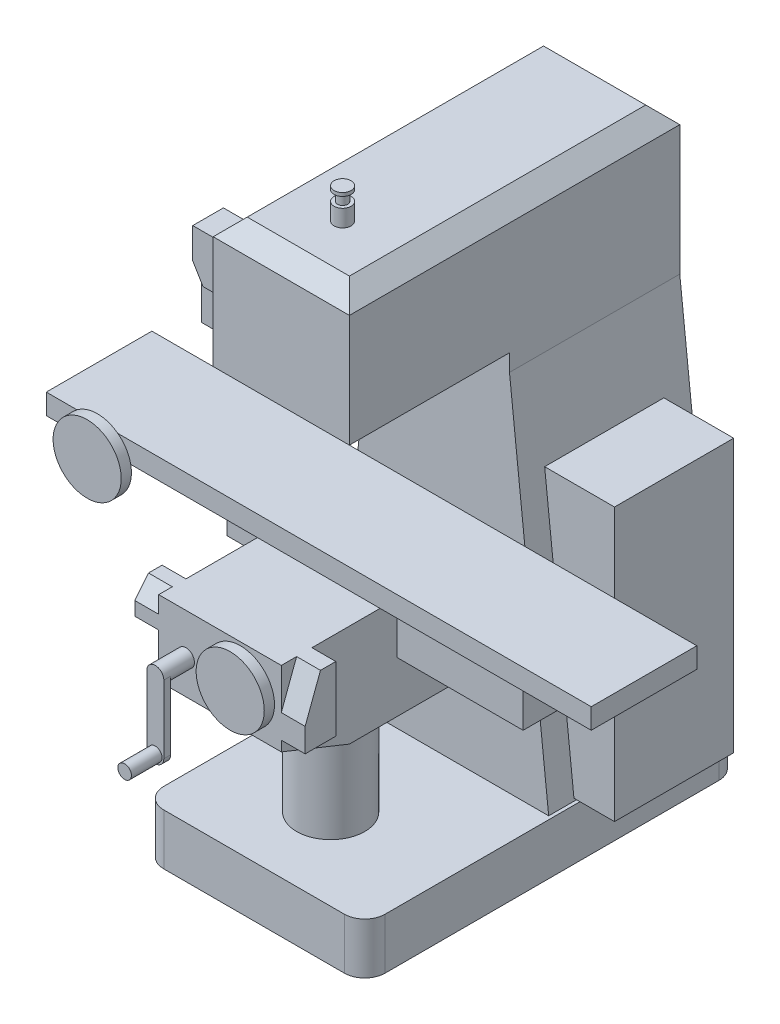
from build123d import *

# Parameters (mm, degrees)
SKETCH_2_W          = 400
SKETCH_2_H          = 430
EXTRUDE_2_DEPTH     = 970
EXTRUDE_3_DEPTH     = 500
SKETCH_4_W          = 650
SKETCH_4_H          = 1100
EXTRUDE_4_DEPTH     = 150
SKETCH_5_R          = 25
EXTRUDE_5_DEPTH     = 50
SKETCH_6_R          = 15
EXTRUDE_6_DEPTH     = 30
SKETCH_7_R          = 25
EXTRUDE_7_DEPTH     = 10
CHAMFER_1_SIZE      = 50
SKETCH_8_R          = 55
EXTRUDE_8_DEPTH     = 20
SKETCH_9_R          = 50
EXTRUDE_9_DEPTH     = 40
CHAMFER_2_SIZE      = 15
SKETCH_10_R         = 10
EXTRUDE_10_DEPTH    = 50
SKETCH_11_W         = 360
SKETCH_11_H         = 300
EXTRUDE_11_DEPTH    = 660
SKETCH_12_W         = 1600
SKETCH_12_H         = 310
EXTRUDE_12_DEPTH    = 60
SKETCH_13_W         = 350
SKETCH_13_H         = 800
EXTRUDE_13_DEPTH    = 570
SKETCH_14_R         = 100
EXTRUDE_14_DEPTH    = 400
EXTRUDE_15_DEPTH    = 100
CUT_EXTRUDE_1_DEPTH = 10
SKETCH_17_R         = 100
EXTRUDE_16_DEPTH    = 30
CUT_EXTRUDE_2_REACH = 2181.284
SKETCH_19_W         = 370
SKETCH_19_H         = 210
EXTRUDE_17_DEPTH    = 150
SKETCH_20_W         = 150
SKETCH_20_H         = 200
EXTRUDE_18_DEPTH    = 100
SKETCH_21_R         = 25
EXTRUDE_19_DEPTH    = 70
SKETCH_22_R         = 100
EXTRUDE_20_DEPTH    = 30
EXTRUDE_21_DEPTH    = 20
SKETCH_24_R         = 20
EXTRUDE_22_DEPTH    = 90
SKETCH_25_W         = 80
SKETCH_25_H         = 90
EXTRUDE_23_DEPTH    = 70
CUT_EXTRUDE_3_DEPTH = 70
SKETCH_27_W         = 90
SKETCH_27_H         = 190
EXTRUDE_24_DEPTH    = 70
CUT_EXTRUDE_4_DEPTH = 70
FILLET_1_R          = 60
SKETCH_29_W         = 50
SKETCH_29_H         = 50
EXTRUDE_25_DEPTH    = 200
SKETCH_30_W         = 50
SKETCH_30_H         = 50
EXTRUDE_26_DEPTH    = 150
SKETCH_31_W         = 260
SKETCH_31_H         = 160
EXTRUDE_27_DEPTH    = 80


with BuildPart() as part:
    # ｽｹｯﾁ2 → ﾎﾞｽ - 押し出し2 (new body)
    with BuildSketch(Plane.XY):
        with Locations((136.676642933, -128.098797217)):
            Rectangle(SKETCH_2_W, SKETCH_2_H)
    extrude(amount=EXTRUDE_2_DEPTH)

    # ｽｹｯﾁ3 → ﾎﾞｽ - 押し出し3 (add)
    with BuildSketch(Plane(origin=(0, 0, 0), x_dir=(-1, 0, 0), z_dir=(0, 0, -1))):
        Polygon((63.323357067, -343.098797217), (-336.676642933, -343.098797217), (-451.676642933, -1413.098797217), (178.323357067, -1413.098797217), align=None)
    extrude(amount=-EXTRUDE_3_DEPTH)

    # ｽｹｯﾁ4 → ﾎﾞｽ - 押し出し4 (add)
    with BuildSketch(Plane(origin=(0, -1413.098797217, 0), x_dir=(-1, 0, 0), z_dir=(0, -1, 0))):
        with Locations((-136.676642933, -500)):
            Rectangle(SKETCH_4_W, SKETCH_4_H)
    extrude(amount=EXTRUDE_4_DEPTH)

    # ｽｹｯﾁ5 → ﾎﾞｽ - 押し出し5 (add)
    with BuildSketch(Plane(origin=(0, 86.901202783, 0), x_dir=(1, 0, 0), z_dir=(0, 1, 0))):
        with Locations((136.676642933, -790)):
            Circle(SKETCH_5_R)
    extrude(amount=EXTRUDE_5_DEPTH)

    # ｽｹｯﾁ6 → ﾎﾞｽ - 押し出し6 (add)
    with BuildSketch(Plane(origin=(0, 136.901202783, 0), x_dir=(1, 0, 0), z_dir=(0, 1, 0))):
        with Locations((136.676642933, -790)):
            Circle(SKETCH_6_R)
    extrude(amount=EXTRUDE_6_DEPTH)

    # ｽｹｯﾁ7 → ﾎﾞｽ - 押し出し7 (add)
    with BuildSketch(Plane(origin=(0, 166.901202783, 0), x_dir=(1, 0, 0), z_dir=(0, 1, 0))):
        with Locations((136.676642933, -790)):
            Circle(SKETCH_7_R)
    extrude(amount=EXTRUDE_7_DEPTH)

    # 面取り1
    chamfer_1_edges = [part.edges().sort_by_distance(p)[0] for p in [
        (-63.323357067, 86.901202783, 485),
        (136.676642933, 86.901202783, 0),
        (136.676642933, 86.901202783, 970),
        (336.676642933, 86.901202783, 485),
        (-63.323357067, -343.098797217, 735),
        (336.676642933, -343.098797217, 735),
        (136.676642933, -343.098797217, 970),
    ]]
    chamfer(chamfer_1_edges, length=CHAMFER_1_SIZE)

    # ｽｹｯﾁ8 → ﾎﾞｽ - 押し出し8 (add)
    with BuildSketch(Plane(origin=(0, -343.098797217, 0), x_dir=(-1, 0, 0), z_dir=(0, -1, 0))):
        with Locations((-136.676642933, -790)):
            Circle(SKETCH_8_R)
    extrude(amount=EXTRUDE_8_DEPTH)

    # ｽｹｯﾁ9 → ﾎﾞｽ - 押し出し9 (add)
    with BuildSketch(Plane(origin=(0, -363.098797217, 0), x_dir=(-1, 0, 0), z_dir=(0, -1, 0))):
        with Locations((-136.676642933, -790)):
            Circle(SKETCH_9_R)
    extrude(amount=EXTRUDE_9_DEPTH)

    # 面取り2
    chamfer_2_edges = [part.edges().sort_by_distance(p)[0] for p in [
        (186.676642933, -403.098797217, 790),
    ]]
    chamfer(chamfer_2_edges, length=CHAMFER_2_SIZE)

    # ｽｹｯﾁ10 → ﾎﾞｽ - 押し出し10 (add)
    with BuildSketch(Plane(origin=(0, -403.098797217, 0), x_dir=(-1, 0, 0), z_dir=(0, -1, 0))):
        with Locations((-136.676642933, -790)):
            Circle(SKETCH_10_R)
    extrude(amount=EXTRUDE_10_DEPTH)

    # ｽｹｯﾁ11 → ﾎﾞｽ - 押し出し11 (add)
    with BuildSketch(Plane.XY.offset(500)):
        with Locations((146.676642933, -913.098797217)):
            Rectangle(SKETCH_11_W, SKETCH_11_H)
    extrude(amount=EXTRUDE_11_DEPTH)

    # ｽｹｯﾁ12 → ﾎﾞｽ - 押し出し12 (add)
    with BuildSketch(Plane(origin=(0, -763.098797217, 0), x_dir=(1, 0, 0), z_dir=(0, 1, 0))):
        with Locations((146.676642933, -715)):
            Rectangle(SKETCH_12_W, SKETCH_12_H)
    extrude(amount=EXTRUDE_12_DEPTH)

    # ｽｹｯﾁ13 → ﾎﾞｽ - 押し出し13 (add)
    with BuildSketch(Plane(origin=(0, 0, 0), x_dir=(0, 0, -1), z_dir=(1, 0, 0))):
        with Locations((-250, -1006.142275478)):
            Rectangle(SKETCH_13_W, SKETCH_13_H)
    extrude(amount=EXTRUDE_13_DEPTH)

    # ｽｹｯﾁ14 → ﾎﾞｽ - 押し出し14 (add)
    with BuildSketch(Plane(origin=(0, -1413.098797217, 0), x_dir=(1, 0, 0), z_dir=(0, 1, 0))):
        with Locations((121.676642933, -810)):
            Circle(SKETCH_14_R)
    extrude(amount=EXTRUDE_14_DEPTH)

    # ｽｹｯﾁ15 → ﾎﾞｽ - 押し出し15 (add)
    with BuildSketch(Plane.XY.offset(970)):
        Polygon((-63.323357067, 25.333856753), (-133.323357067, 25.333856753), (-133.323357067, -64.666143247), (-103.323357067, -114.666143247), (-63.323357067, -114.666143247), align=None)
    extrude(amount=-EXTRUDE_15_DEPTH)

    # ｽｹｯﾁ16 → ｶｯﾄ - 押し出し1 (cut)
    with BuildSketch(Plane.XY.offset(970)):
        Polygon((-63.323357067, 25.333856753), (-133.323357067, 25.333856753), (-133.323357067, -64.666143247), (-103.323357067, -114.666143247), (-63.323357067, -114.666143247), align=None)
    extrude(amount=-CUT_EXTRUDE_1_DEPTH, mode=Mode.SUBTRACT)

    # ｽｹｯﾁ17 → ﾎﾞｽ - 押し出し16 (add)
    with BuildSketch(Plane.XY.offset(870)):
        with Locations((-503.323357067, -783.098797217)):
            Circle(SKETCH_17_R)
    extrude(amount=EXTRUDE_16_DEPTH)

    # ｽｹｯﾁ18 → ｶｯﾄ - 押し出し2 (cut, up to next)
    with BuildSketch(Plane.ZY.offset(33.323357067), mode=Mode.PRIVATE) as cut_extrude_2_sk1:
        Polygon((1160, -1063.098797217), (1160, -983.098797217), (960, -1063.098797217), align=None)
    cut_extrude_2_tool1 = extrude(cut_extrude_2_sk1.sketch, amount=-CUT_EXTRUDE_2_REACH, mode=Mode.PRIVATE) & part.part
    add(cut_extrude_2_tool1.solids().sort_by_distance((-33.323357, -1036.432131, 1093.333333))[0], mode=Mode.SUBTRACT)

    # ｽｹｯﾁ19 → ﾎﾞｽ - 押し出し17 (add)
    with BuildSketch(Plane(origin=(0, -763.098797217, 0), x_dir=(-1, 0, 0), z_dir=(0, -1, 0))):
        with Locations((-511.676642933, -715)):
            Rectangle(SKETCH_19_W, SKETCH_19_H)
    extrude(amount=EXTRUDE_17_DEPTH)

    # ｽｹｯﾁ20 → ﾎﾞｽ - 押し出し18 (add)
    with BuildSketch(Plane(origin=(0, -763.098797217, 0), x_dir=(-1, 0, 0), z_dir=(0, -1, 0))):
        with Locations((108.323357067, -710)):
            Rectangle(SKETCH_20_W, SKETCH_20_H)
    extrude(amount=EXTRUDE_18_DEPTH)

    # ｽｹｯﾁ21 → ﾎﾞｽ - 押し出し19 (add)
    with BuildSketch(Plane.XY.offset(1160)):
        with Locations((46.676642933, -883.098797217)):
            Circle(SKETCH_21_R)
    extrude(amount=EXTRUDE_19_DEPTH)

    # ｽｹｯﾁ22 → ﾎﾞｽ - 押し出し20 (add)
    with BuildSketch(Plane.XY.offset(1160)):
        with Locations((206.676642933, -873.098797217)):
            Circle(SKETCH_22_R)
    extrude(amount=EXTRUDE_20_DEPTH)

    # ｽｹｯﾁ23 → ﾎﾞｽ - 押し出し21 (add)
    with BuildSketch(Plane.XY.offset(1230)):
        with BuildLine():
            Line((21.676642933, -883.098797217), (21.676642933, -1083.098797217))
            ThreePointArc((21.676642933, -1083.098797217), (46.676642933, -1108.098797217), (71.676642933, -1083.098797217))
            Line((71.676642933, -1083.098797217), (71.676642933, -883.098797217))
            ThreePointArc((71.676642933, -883.098797217), (46.676642933, -858.098797217), (21.676642933, -883.098797217))
        make_face()
    extrude(amount=EXTRUDE_21_DEPTH)

    # ｽｹｯﾁ24 → ﾎﾞｽ - 押し出し22 (add)
    with BuildSketch(Plane.XY.offset(1250)):
        with Locations((46.676642933, -1083.098797217)):
            Circle(SKETCH_24_R)
    extrude(amount=EXTRUDE_22_DEPTH)

    # ｽｹｯﾁ25 → ﾎﾞｽ - 押し出し23 (add)
    with BuildSketch(Plane.ZY.offset(33.323357067)):
        with Locations((1120, -808.098797217)):
            Rectangle(SKETCH_25_W, SKETCH_25_H)
    extrude(amount=EXTRUDE_23_DEPTH)

    # ｽｹｯﾁ26 → ｶｯﾄ - 押し出し3 (cut)
    with BuildSketch(Plane.ZY.offset(103.323357067)):
        Polygon((1160, -763.098797217), (1120, -763.098797217), (1160, -813.098797217), align=None)
    extrude(amount=-CUT_EXTRUDE_3_DEPTH, mode=Mode.SUBTRACT)

    # ｽｹｯﾁ27 → ﾎﾞｽ - 押し出し24 (add)
    with BuildSketch(Plane(origin=(326.676642933, 0, 0), x_dir=(0, 0, -1), z_dir=(1, 0, 0))):
        with Locations((-1115, -858.098797217)):
            Rectangle(SKETCH_27_W, SKETCH_27_H)
    extrude(amount=EXTRUDE_24_DEPTH)

    # ｽｹｯﾁ28 → ｶｯﾄ - 押し出し4 (cut)
    with BuildSketch(Plane(origin=(396.676642933, 0, 0), x_dir=(0, 0, -1), z_dir=(1, 0, 0))):
        Polygon((-1115, -763.098797217), (-1160, -883.098797217), (-1160, -763.098797217), align=None)
    extrude(amount=-CUT_EXTRUDE_4_DEPTH, mode=Mode.SUBTRACT)

    # ﾌｨﾚｯﾄ1
    fillet_1_edges = [part.edges().sort_by_distance(p)[0] for p in [
        (-188.323357067, -1488.098797217, -50),
        (461.676642933, -1488.098797217, -50),
        (-188.323357067, -1488.098797217, 1050),
        (461.676642933, -1488.098797217, 1050),
    ]]
    fillet(fillet_1_edges, radius=FILLET_1_R)

    # ｽｹｯﾁ29 → ﾎﾞｽ - 押し出し25 (add)
    with BuildSketch(Plane.ZY.offset(63.323357067)):
        with Locations((445, -388.098797217)):
            Rectangle(SKETCH_29_W, SKETCH_29_H)
    extrude(amount=EXTRUDE_25_DEPTH)

    # ｽｹｯﾁ30 → ﾎﾞｽ - 押し出し26 (add)
    with BuildSketch(Plane.XY.offset(470)):
        with Locations((-238.323357067, -388.098797217)):
            Rectangle(SKETCH_30_W, SKETCH_30_H)
    extrude(amount=EXTRUDE_26_DEPTH)

    # ｽｹｯﾁ31 → ﾎﾞｽ - 押し出し27 (add)
    with BuildSketch(Plane.XY.offset(620)):
        with Locations((-238.323357067, -388.098797217)):
            Rectangle(SKETCH_31_W, SKETCH_31_H)
    extrude(amount=EXTRUDE_27_DEPTH)


solid = part.part
